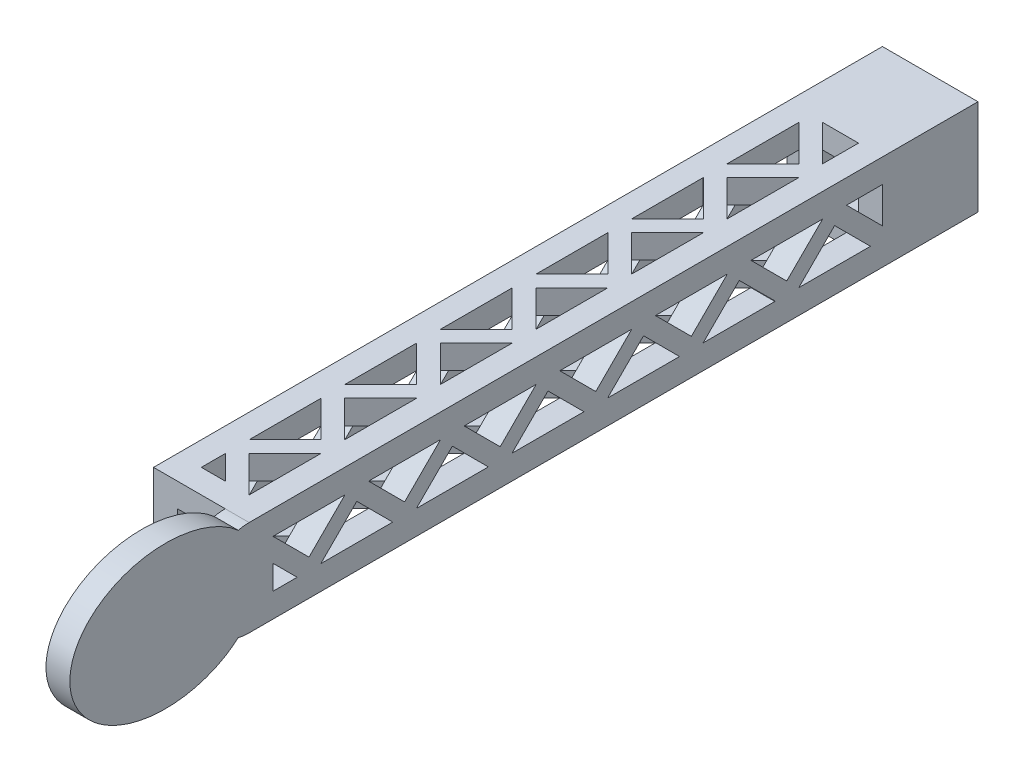
from build123d import *

# Parameters (mm, degrees)
SKETCH1_W           = 20.32
SKETCH1_H           = 20.32
SKETCH1_W_2         = 10.16
SKETCH1_H_2         = 10.16
BOSS_EXTRUDE1_DEPTH = 154.94
SKETCH6_OUTSIDE_W   = 53.836
SKETCH6_OUTSIDE_H   = 188.456
SKETCH6_OUTSIDE_W_2 = 20.32
SKETCH6_OUTSIDE_H_2 = 154.94
CUT_EXTRUDE1_DEPTH  = 158.582386072
CUT_EXTRUDE6_DEPTH  = 173.191597598
BOSS_EXTRUDE2_DEPTH = 5.08


with BuildPart() as part:
    # Sketch1 → Boss-Extrude1 (new body)
    with BuildSketch(Plane.XY):
        with Locations((10.16, 10.16)):
            Rectangle(SKETCH1_W, SKETCH1_H)
        with Locations((10.16, 10.16)):
            Rectangle(SKETCH1_W_2, SKETCH1_H_2, mode=Mode.SUBTRACT)
    extrude(amount=BOSS_EXTRUDE1_DEPTH)

    # Sketch6 outside → Cut-Extrude1 (cut, through all)
    # profile 1 of 15: a face of its own
    with BuildSketch(Plane(origin=(0, 20.32, 0), x_dir=(1, 0, 0), z_dir=(0, 1, 0))):
        with Locations((10.16, -77.47)):
            Rectangle(SKETCH6_OUTSIDE_W, SKETCH6_OUTSIDE_H)
        with Locations((10.16, -77.47)):
            Rectangle(SKETCH6_OUTSIDE_W_2, SKETCH6_OUTSIDE_H_2, mode=Mode.SUBTRACT)
    # profile 2 of 15: a face of its own
    with BuildSketch(Plane(origin=(0, 20.32, 0), x_dir=(1, 0, 0), z_dir=(0, 1, 0))):
        Polygon((10.213730742, -149.86), (5.08, -149.86), (5.08, -144.726269258), align=None)
    # profile 3 of 15: a face of its own
    with BuildSketch(Plane(origin=(0, 20.32, 0), x_dir=(1, 0, 0), z_dir=(0, 1, 0))):
        Polygon((5.08, -139.7), (5.08, -124.406269258), (12.726865371, -132.053134629), align=None)
    # profile 4 of 15: a face of its own
    with BuildSketch(Plane(origin=(0, 20.32, 0), x_dir=(1, 0, 0), z_dir=(0, 1, 0))):
        Polygon((5.08, -119.38), (5.08, -104.086269258), (12.726865371, -111.733134629), align=None)
    # profile 5 of 15: a face of its own
    with BuildSketch(Plane(origin=(0, 20.32, 0), x_dir=(1, 0, 0), z_dir=(0, 1, 0))):
        Polygon((5.08, -99.06), (5.08, -83.766269258), (12.726865371, -91.413134629), align=None)
    # profile 6 of 15: a face of its own
    with BuildSketch(Plane(origin=(0, 20.32, 0), x_dir=(1, 0, 0), z_dir=(0, 1, 0))):
        Polygon((7.593134629, -142.213134629), (15.24, -134.566269258), (15.24, -149.86), align=None)
    # profile 7 of 15: a face of its own
    with BuildSketch(Plane(origin=(0, 20.32, 0), x_dir=(1, 0, 0), z_dir=(0, 1, 0))):
        Polygon((7.593134629, -121.893134629), (15.24, -114.246269258), (15.24, -129.54), align=None)
    # profile 8 of 15: a face of its own
    with BuildSketch(Plane(origin=(0, 20.32, 0), x_dir=(1, 0, 0), z_dir=(0, 1, 0))):
        Polygon((7.593134629, -101.573134629), (15.24, -93.926269258), (15.24, -109.22), align=None)
    # profile 9 of 15: a face of its own
    with BuildSketch(Plane(origin=(0, 20.32, 0), x_dir=(1, 0, 0), z_dir=(0, 1, 0))):
        Polygon((7.593134629, -81.253134629), (15.24, -73.606269258), (15.24, -88.9), align=None)
    # profile 10 of 15: a face of its own
    with BuildSketch(Plane(origin=(0, 20.32, 0), x_dir=(1, 0, 0), z_dir=(0, 1, 0))):
        Polygon((5.08, -78.74), (5.08, -63.446269258), (12.726865371, -71.093134629), align=None)
    # profile 11 of 15: a face of its own
    with BuildSketch(Plane(origin=(0, 20.32, 0), x_dir=(1, 0, 0), z_dir=(0, 1, 0))):
        Polygon((5.08, -43.18), (5.133730742, -43.126269258), (12.733528294, -50.766471706), (5.08, -58.42), align=None)
    # profile 12 of 15: a face of its own
    with BuildSketch(Plane(origin=(0, 20.32, 0), x_dir=(1, 0, 0), z_dir=(0, 1, 0))):
        Polygon((5.08, -38.1), (5.08, -22.86), (12.7, -30.48), align=None)
    # profile 13 of 15: a face of its own
    with BuildSketch(Plane(origin=(0, 20.32, 0), x_dir=(1, 0, 0), z_dir=(0, 1, 0))):
        Polygon((7.593134629, -60.933134629), (15.24, -53.286269258), (15.24, -68.58), align=None)
    # profile 14 of 15: a face of its own
    with BuildSketch(Plane(origin=(0, 20.32, 0), x_dir=(1, 0, 0), z_dir=(0, 1, 0))):
        Polygon((7.62, -40.64), (15.24, -33.02), (15.24, -48.26), align=None)
    # profile 15 of 15: a face of its own
    with BuildSketch(Plane(origin=(0, 20.32, 0), x_dir=(1, 0, 0), z_dir=(0, 1, 0))):
        Polygon((15.24, -27.94), (7.62, -20.32), (15.24, -20.32), align=None)
    extrude(amount=-CUT_EXTRUDE1_DEPTH, mode=Mode.SUBTRACT)

    # Sketch8 → Cut-Extrude6 (cut, through all)
    with BuildSketch(Plane(origin=(0, -104.692843029, 116.656902758), x_dir=(0, 1, 0), z_dir=(-1, 0, 0))):
        Polygon((119.932843029, 96.336902758), (112.312843029, 96.336902758), (119.932843029, 88.716902758), align=None)
        Polygon((117.448556321, 86.176902758), (109.828556321, 93.796902758), (109.828556321, 78.556902758), align=None)
        Polygon((109.828556321, -28.0693665), (109.828556321, -33.203097242), (114.962287063, -33.203097242), align=None)
        Polygon((119.932843029, 68.396902758), (119.932843029, 83.636902758), (112.333792954, 75.995952833), align=None)
        Polygon((117.492285501, 65.900885432), (109.881992425, 73.5306335), (109.828556321, 73.476902758), (109.828556321, 58.236902758), align=None)
        Polygon((119.932843029, 48.076902758), (119.932843029, 63.3706335), (112.285977658, 55.723768129), align=None)
        Polygon((117.475421692, 45.563768129), (109.828556321, 53.2106335), (109.828556321, 37.916902758), align=None)
        Polygon((119.932843029, 27.756902758), (119.932843029, 43.0506335), (112.285977658, 35.403768129), align=None)
        Polygon((117.475421692, 25.243768129), (109.828556321, 32.8906335), (109.828556321, 17.596902758), align=None)
        Polygon((119.932843029, 7.436902758), (119.932843029, 22.7306335), (112.285977658, 15.083768129), align=None)
        Polygon((117.475421692, 4.923768129), (109.828556321, 12.5706335), (109.828556321, -2.723097242), align=None)
        Polygon((119.932843029, -12.883097242), (119.932843029, 2.4106335), (112.285977658, -5.236231871), align=None)
        Polygon((117.475421692, -15.396231871), (109.828556321, -7.7493665), (109.828556321, -23.043097242), align=None)
        Polygon((119.932843029, -33.203097242), (119.932843029, -17.9093665), (112.285977658, -25.556231871), align=None)
    extrude(amount=-CUT_EXTRUDE6_DEPTH, mode=Mode.SUBTRACT)

    # Sketch10 → Boss-Extrude2 (add)
    with BuildSketch(Plane(origin=(20.32, 0, 0), x_dir=(0, 0, -1), z_dir=(1, 0, 0))):
        with BuildLine():
            Line((-154.94, 20.32), (-154.94, 0))
            ThreePointArc((-154.94, 0), (-156.108424533, 0.067409445), (-157.261344569, 0.268743285))
            add(Edge.make_bspline(
                [(-157.261344569, 20.051256715), (-193.04, 51.504597899), (-193.04, 10.16), (-193.04, -31.184597899), (-157.261344569, 0.268743285)],
                knots=[3.847904768, 3.847904768, 3.847904768, 6.283185307, 6.283185307, 8.718465846, 8.718465846, 8.718465846], degree=2, weights=[1, 0.345860809, 1, 0.345860809, 1]))
            ThreePointArc((-157.261344569, 20.051256715), (-156.108424533, 20.252590555), (-154.94, 20.32))
        make_face()
    extrude(amount=-BOSS_EXTRUDE2_DEPTH)


solid = part.part
